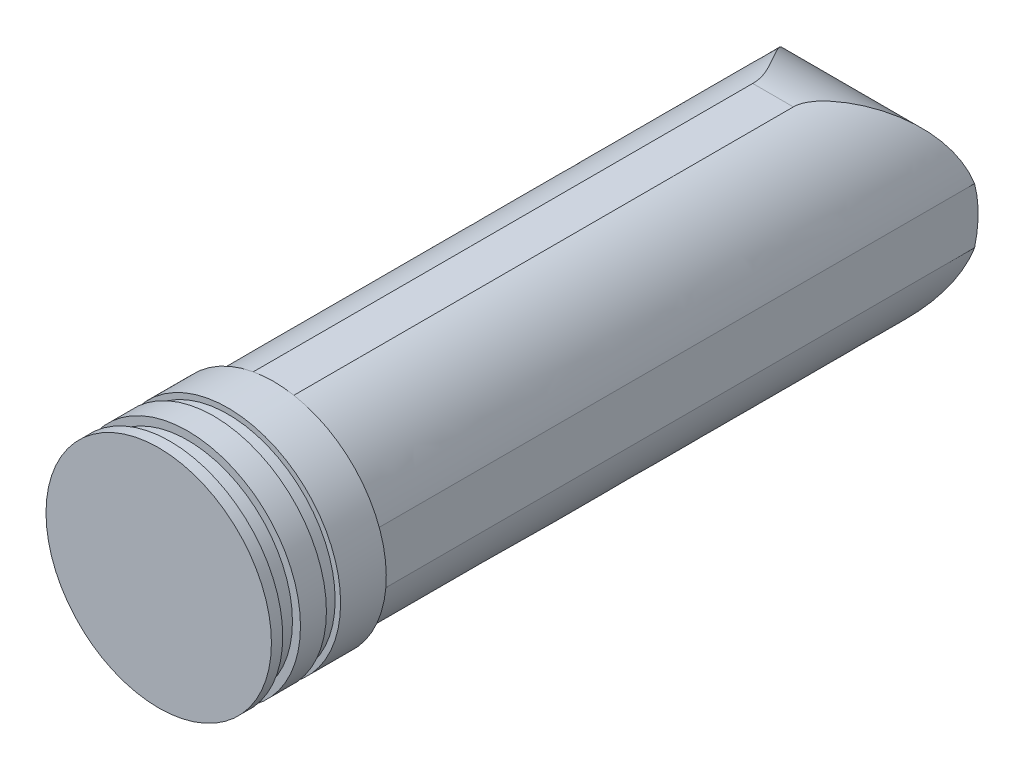
from build123d import *

# Parameters (mm, degrees)
BOSS_EXTRUDE13_DEPTH = 1700
FILLET10_R           = 170
FILLET12_R           = 170
SKETCH16_RX          = 1022.583200286
SKETCH16_RY          = 876.683306515
CUT_EXTRUDE2_DEPTH   = 30000
BOSS_EXTRUDE14_START = -254
BOSS_EXTRUDE14_DEPTH = 412
SKETCH18_R           = 967.471157333
BOSS_EXTRUDE15_DEPTH = 128
SKETCH19_R           = 1016.647020422
BOSS_EXTRUDE16_DEPTH = 234
SKETCH20_R           = 944.448472279
BOSS_EXTRUDE17_DEPTH = 160
SKETCH21_R           = 1016.647020422
BOSS_EXTRUDE18_DEPTH = 102


with BuildPart() as part:
    # Sketch15 → Boss-Extrude13 (new body)
    with BuildSketch(Plane(origin=(0, 0, 0), x_dir=(0, 0, -1), z_dir=(1, 0, 0))):
        with BuildLine():
            Line((0, 1000), (-4759.042111415, 1000))
            Line((-4759.042111415, 1000), (-4759.042111415, -700))
            Line((-4759.042111415, -700), (-3259.042111415, -700))
            Line((-3259.042111415, -700), (-182.556285222, -983.195404142))
            ThreePointArc((-182.556285222, -983.195404142), (995.789988939, -91.664049272), (0, 1000))
        make_face()
    extrude(amount=BOSS_EXTRUDE13_DEPTH)

    # Fillet10
    fillet10_edges = [part.edges().sort_by_distance(p)[0] for p in [
        (850, 1000, 4759.042111415),
    ]]
    fillet(fillet10_edges, radius=FILLET10_R)

    # Fillet12
    fillet12_edges = [part.edges().sort_by_distance(p)[0] for p in [
        (850, -700, 4759.042111415),
    ]]
    fillet(fillet12_edges, radius=FILLET12_R)

    # Sketch16 → Cut-Extrude2 (cut)
    with BuildSketch(Plane.XY.offset(4759.042111415)):
        Polygon((850, 1022.583200286), (-26.683306515, 1022.583200286), (-26.683306515, 0), (-26.683306515, -1022.583200286), (850, -1022.583200286), (1726.683306515, -1022.583200286), (1726.683306515, 0), (1726.683306515, 1022.583200286), align=None)
        with Locations(Location((850, 0), (0, 0, 90))):
            Ellipse(SKETCH16_RX, SKETCH16_RY, mode=Mode.SUBTRACT)
    extrude(amount=-CUT_EXTRUDE2_DEPTH, mode=Mode.SUBTRACT)

    # Boss-Extrude14: read off the stored shape, not the designer's step
    # Boss-Extrude14 outline → Boss-Extrude14 (add)
    with BuildSketch(Plane.XY.offset(4759.042111415).offset(BOSS_EXTRUDE14_START)):
        with BuildLine():
            ThreePointArc((1033.224354637, 1000), (850, 1016.647020422), (666.775645363, 1000))
            Line((666.775645363, 1000), (1033.224354637, 1000))
        make_face()
        with BuildLine():
            Line((1033.224354637, 1000), (666.775645363, 1000))
            ThreePointArc((666.775645363, 1000), (666.770213652, 999.999004763), (666.764781947, 999.998009496))
            add(Edge.make_bspline(
                [(666.764781947, 999.998009496), (487.065552337, 955.199056697), (337.914894875, 830)],
                knots=[0.210562071, 0.210562071, 0.210562071, 0.627266458, 0.627266458, 0.627266458], degree=2, weights=[1, 0.943512641, 0.929327331]))
            Line((337.914894875, 830), (1362.085105125, 830))
            add(Edge.make_bspline(
                [(1362.085105125, 830), (1212.934447663, 955.199056697), (1033.235218053, 999.998009496)],
                knots=[5.655918849, 5.655918849, 5.655918849, 6.072623236, 6.072623236, 6.072623236], degree=2, weights=[0.929327331, 0.943512641, 1]))
            ThreePointArc((1033.235218053, 999.998009496), (1033.229786348, 999.999004763), (1033.224354637, 1000))
        make_face()
        with BuildLine():
            add(Edge.make_bspline(
                [(666.764781947, 999.998009496), (487.065552337, 955.199056697), (337.914894875, 830)],
                knots=[0.210562071, 0.210562071, 0.210562071, 0.627266458, 0.627266458, 0.627266458], degree=2, weights=[1, 0.943512641, 0.929327331]))
            ThreePointArc((666.764781947, 999.998009496), (199.121506861, -780.979097864), (1866.647020422, 0))
            ThreePointArc((1866.647020422, 0), (1630.979097864, 650.878493139), (1033.235218053, 999.998009496))
            add(Edge.make_bspline(
                [(1362.085105125, 830), (1212.934447663, 955.199056697), (1033.235218053, 999.998009496)],
                knots=[5.655918849, 5.655918849, 5.655918849, 6.072623236, 6.072623236, 6.072623236], degree=2, weights=[0.929327331, 0.943512641, 1]))
            add(Edge.make_bspline(
                [(1700, 250.369881779), (1621.690049206, 612.084137837), (1362.085105125, 830)],
                knots=[4.959744263, 4.959744263, 4.959744263, 5.655918849, 5.655918849, 5.655918849], degree=2, weights=[1, 0.905628391, 0.929327331]))
            Line((1700, 250.369881779), (1700, -250.369881779))
            add(Edge.make_bspline(
                [(1599.741106269, -530), (1667.833449295, -398.947423205), (1700, -250.369881779)],
                knots=[4.167762041, 4.167762041, 4.167762041, 4.465033698, 4.465033698, 4.465033698], degree=2, weights=[0.9845248, 0.981275035, 1]))
            add(Edge.make_bspline(
                [(1489.079755207, -700), (1552.057759876, -621.772806415), (1599.741106269, -530)],
                knots=[3.958415289, 3.958415289, 3.958415289, 4.167762041, 4.167762041, 4.167762041], degree=2, weights=[1, 0.986813373, 0.9845248]))
            Line((1489.079755207, -700), (210.920244793, -700))
            add(Edge.make_bspline(
                [(100.258893731, -530), (147.942240124, -621.772806415), (210.920244793, -700)],
                knots=[2.115423266, 2.115423266, 2.115423266, 2.324770018, 2.324770018, 2.324770018], degree=2, weights=[0.9845248, 0.986813373, 1]))
            add(Edge.make_bspline(
                [(0, -250.369881779), (32.166550705, -398.947423205), (100.258893731, -530)],
                knots=[1.818151609, 1.818151609, 1.818151609, 2.115423266, 2.115423266, 2.115423266], degree=2, weights=[1, 0.981275035, 0.9845248]))
            Line((0, -250.369881779), (0, 250.369881779))
            add(Edge.make_bspline(
                [(337.914894875, 830), (78.309950794, 612.084137837), (0, 250.369881779)],
                knots=[0.627266458, 0.627266458, 0.627266458, 1.323441044, 1.323441044, 1.323441044], degree=2, weights=[0.929327331, 0.905628391, 1]))
        make_face()
        with BuildLine():
            Line((1362.085105125, 830), (337.914894875, 830))
            add(Edge.make_bspline(
                [(337.914894875, 830), (78.309950794, 612.084137837), (0, 250.369881779)],
                knots=[0.627266458, 0.627266458, 0.627266458, 1.323441044, 1.323441044, 1.323441044], degree=2, weights=[0.929327331, 0.905628391, 1]))
            Line((0, 250.369881779), (0, -250.369881779))
            add(Edge.make_bspline(
                [(0, -250.369881779), (32.166550705, -398.947423205), (100.258893731, -530)],
                knots=[1.818151609, 1.818151609, 1.818151609, 2.115423266, 2.115423266, 2.115423266], degree=2, weights=[1, 0.981275035, 0.9845248]))
            Line((100.258893731, -530), (1599.741106269, -530))
            add(Edge.make_bspline(
                [(1599.741106269, -530), (1667.833449295, -398.947423205), (1700, -250.369881779)],
                knots=[4.167762041, 4.167762041, 4.167762041, 4.465033698, 4.465033698, 4.465033698], degree=2, weights=[0.9845248, 0.981275035, 1]))
            Line((1700, -250.369881779), (1700, 250.369881779))
            add(Edge.make_bspline(
                [(1700, 250.369881779), (1621.690049206, 612.084137837), (1362.085105125, 830)],
                knots=[4.959744263, 4.959744263, 4.959744263, 5.655918849, 5.655918849, 5.655918849], degree=2, weights=[1, 0.905628391, 0.929327331]))
        make_face()
        with BuildLine():
            Line((1599.741106269, -530), (100.258893731, -530))
            add(Edge.make_bspline(
                [(100.258893731, -530), (147.942240124, -621.772806415), (210.920244793, -700)],
                knots=[2.115423266, 2.115423266, 2.115423266, 2.324770018, 2.324770018, 2.324770018], degree=2, weights=[0.9845248, 0.986813373, 1]))
            Line((210.920244793, -700), (1489.079755207, -700))
            add(Edge.make_bspline(
                [(1489.079755207, -700), (1552.057759876, -621.772806415), (1599.741106269, -530)],
                knots=[3.958415289, 3.958415289, 3.958415289, 4.167762041, 4.167762041, 4.167762041], degree=2, weights=[1, 0.986813373, 0.9845248]))
        make_face()
    extrude(amount=BOSS_EXTRUDE14_DEPTH)

    # Sketch18 → Boss-Extrude15 (add)
    with BuildSketch(Plane.XY.offset(4917.042111415)):
        with Locations((850, 0)):
            Circle(SKETCH18_R)
    extrude(amount=BOSS_EXTRUDE15_DEPTH)

    # Sketch19 → Boss-Extrude16 (add)
    with BuildSketch(Plane.XY.offset(5045.042111415)):
        with Locations(Location((850, 0, 0), (0, 0, 100.383439152))):
            Circle(SKETCH19_R)
    extrude(amount=BOSS_EXTRUDE16_DEPTH)

    # Sketch20 → Boss-Extrude17 (add)
    with BuildSketch(Plane.XY.offset(5279.042111415)):
        with Locations(Location((850, 0, 0), (0, 0, 180))):
            Circle(SKETCH20_R)
    extrude(amount=BOSS_EXTRUDE17_DEPTH)

    # Sketch21 → Boss-Extrude18 (add)
    with BuildSketch(Plane.XY.offset(5439.042111415)):
        with Locations(Location((850, 0, 0), (0, 0, 100.383439152))):
            Circle(SKETCH21_R)
    extrude(amount=BOSS_EXTRUDE18_DEPTH)


solid = part.part
